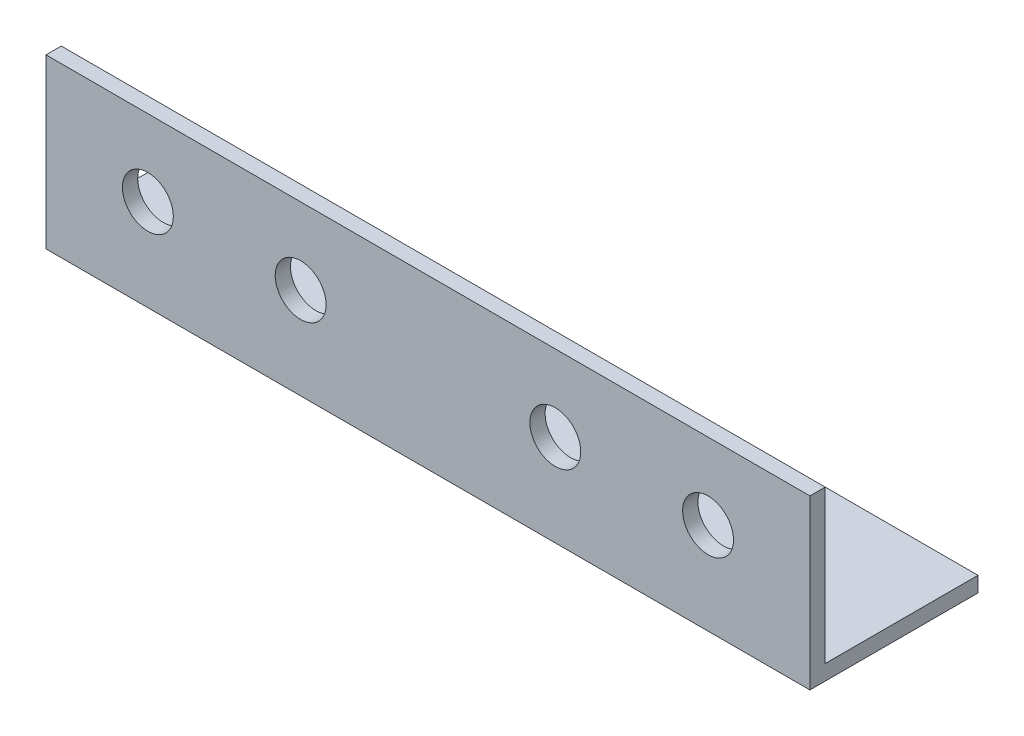
from build123d import *

# Parameters (mm, degrees)
EXTRUDE_1_DEPTH     = 150
SKETCH_2_R          = 5
CUT_EXTRUDE_1_DEPTH = 156.884572681


with BuildPart() as part:
    # Эскиз1 → Вытянуть-Тонкостенный1 (new body)
    with BuildSketch(Plane(origin=(0, 0, 0), x_dir=(0, 0, -1), z_dir=(1, 0, 0))):
        Polygon((0, 30), (0, 0), (30, 0), (30, -3), (-3, -3), (-3, 30), align=None)
    extrude(amount=EXTRUDE_1_DEPTH)

    # Эскиз2 → Вырез-Вытянуть1 (cut, through all)
    with BuildSketch(Plane(origin=(0, 0, 0), x_dir=(-1, 0, 0), z_dir=(0, 0, -1))):
        with Locations((-130, 15)):
            Circle(SKETCH_2_R)
        with Locations((-100, 15)):
            Circle(SKETCH_2_R)
        with Locations((-50, 15)):
            Circle(SKETCH_2_R)
        with Locations((-20, 15)):
            Circle(SKETCH_2_R)
    extrude(amount=-CUT_EXTRUDE_1_DEPTH, mode=Mode.SUBTRACT)


solid = part.part
